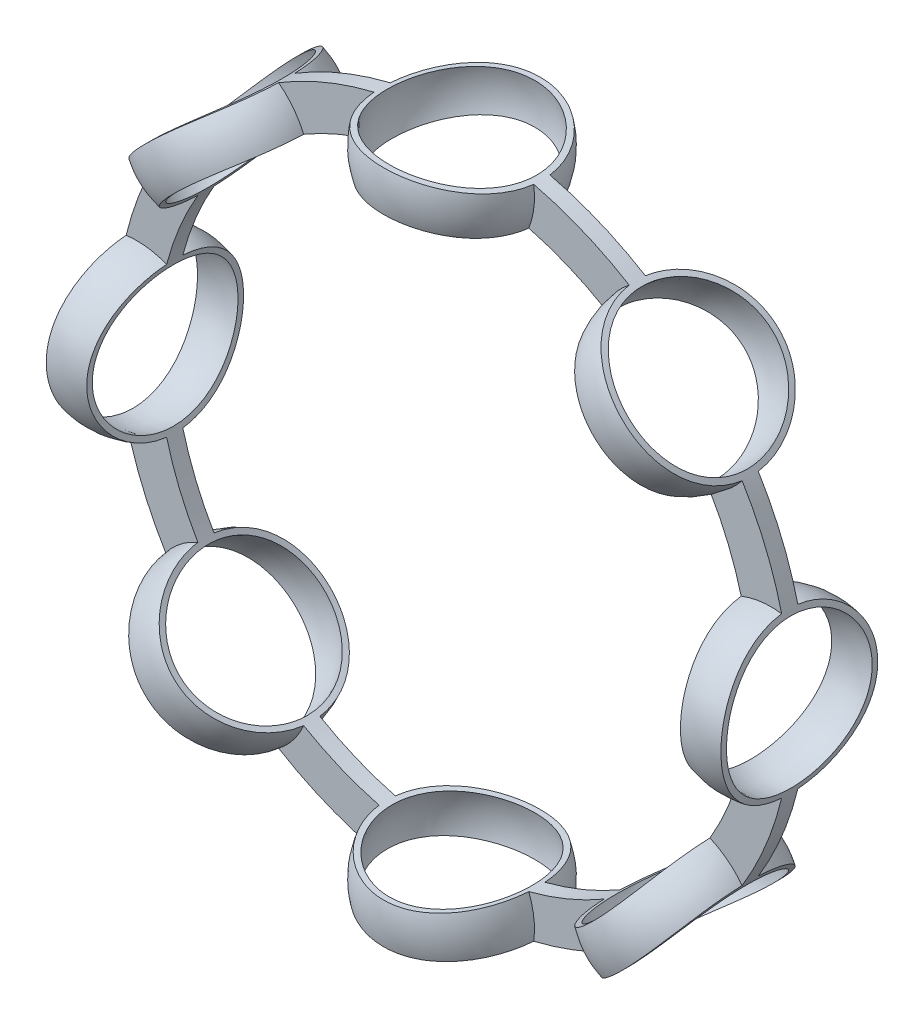
from build123d import *

# Parameters (mm, degrees)
SKETCH_1_R               = 80
EXTRUDE_1_DEPTH          = 1.5
PATTERN_CIRCULAR_1_COUNT = 8
SKETCH_5_OUTSIDE_W       = 207.65
SKETCH_5_OUTSIDE_H       = 207.65
SKETCH_5_OUTSIDE_R       = 62.5
SKETCH_5_OUTSIDE_R_2     = 55
CUT_EXTRUDE_1_DEPTH      = 35
PATTERN_CIRCULAR_2_COUNT = 8


with BuildPart() as part:
    # 草图1 → 拉伸1 (new, symmetric)
    with BuildSketch(Plane.XY):
        Circle(SKETCH_1_R)
    extrude(amount=EXTRUDE_1_DEPTH, both=True)

    # 草图4 → 旋转1 (revolve)
    with BuildSketch(Plane(origin=(0, 0, 0), x_dir=(1, 0, 0), z_dir=(0, 1, 0))):
        with BuildLine():
            Line((58.75, 15), (58.75, -15))
            ThreePointArc((58.75, -15), (73.75, 0), (58.75, 15))
        make_face()
    revolve_1 = revolve(axis=Axis((58.75, 0, -39.664192028), (0, 0, 1)))

    # 阵列(圆周)1: 旋转1 ×8 about axis
    pattern_circular_1_axis = Axis((0, 0, 1.5), (0, 0, -1))
    for i in range(1, PATTERN_CIRCULAR_1_COUNT):
        add(revolve_1.rotate(pattern_circular_1_axis, i * 360 / PATTERN_CIRCULAR_1_COUNT))

    # 草图5 outside → 切除-拉伸1 (cut, symmetric)
    # profile 1 of 2: a face of its own
    with BuildSketch(Plane.XY):
        Rectangle(SKETCH_5_OUTSIDE_W, SKETCH_5_OUTSIDE_H)
        Circle(SKETCH_5_OUTSIDE_R, mode=Mode.SUBTRACT)
    # profile 2 of 2: a face of its own
    with BuildSketch(Plane.XY):
        Circle(SKETCH_5_OUTSIDE_R_2)
    extrude(amount=CUT_EXTRUDE_1_DEPTH, both=True, mode=Mode.SUBTRACT)

    # 草图7 → 切除-旋转1 (revolve, cut)
    with BuildSketch(Plane(origin=(0, 0, 0), x_dir=(1, 0, 0), z_dir=(0, 1, 0))):
        with BuildLine():
            Line((58.75, 14), (58.75, -14))
            ThreePointArc((58.75, -14), (72.75, 0), (58.75, 14))
        make_face()
    cut_revolve_1 = revolve(axis=Axis((58.75, 0, -25.58024305), (0, 0, 1)), mode=Mode.SUBTRACT)

    # 阵列(圆周)2: 切除-旋转1 ×8 about axis
    pattern_circular_2_axis = Axis((0, 0, -35), (0, 0, 1))
    for i in range(1, PATTERN_CIRCULAR_2_COUNT):
        add(cut_revolve_1.rotate(pattern_circular_2_axis, i * 360 / PATTERN_CIRCULAR_2_COUNT), mode=Mode.SUBTRACT)


solid = part.part
